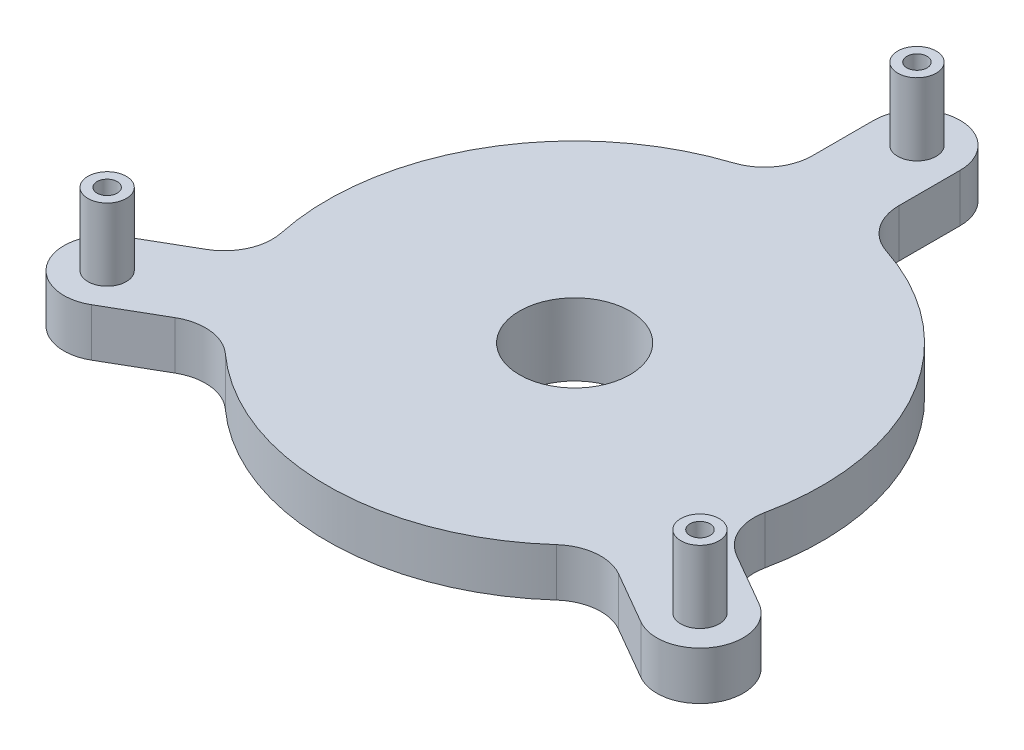
from build123d import *
from build123d.topology import SkipClean

# Parameters (mm, degrees)
SKETCH_1_R               = 82.5
SKETCH_1_R_2             = 11.5
EXTRUDE_1_DEPTH          = 5
SKETCH_2_R               = 4
SKETCH_2_R_2             = 2.1
EXTRUDE_2_DEPTH          = 15
EXTRUDE_START            = 5
SKETCH_3_R               = 34
SKETCH_3_R_2             = 11.5
EXTRUDE_3_DEPTH          = 5
CUT_EXTRUDE_1_DEPTH      = 118.63290356
CUT_EXTRUDE_1_DEPTH_BACK = 10
SKETCH_4_R               = 82.5
EXTRUDE_4_DEPTH          = 5
SKETCH_6_R               = 11.5
CUT_EXTRUDE_2_DEPTH      = 109.80791311
SKETCH_7_R               = 34.75
SKETCH_7_R_2             = 11.5
EXTRUDE_5_DEPTH          = 5


with BuildPart() as part:
    # 草圖1 → 填料-伸長1 (new body)
    with BuildSketch(Plane(origin=(0, 0, 0), x_dir=(1, 0, 0), z_dir=(0, 1, 0))):
        with Locations(Location((0, 0, 0), (0, 0, 270))):
            Circle(SKETCH_1_R)
        with Locations(Location((0, 0, 0), (0, 0, 270))):
            Circle(SKETCH_1_R_2, mode=Mode.SUBTRACT)
    extrude(amount=EXTRUDE_1_DEPTH)

    # 草圖2 → 填料-伸長2 (add)
    # profile 1 of 3: a face of its own
    with BuildSketch(Plane(origin=(0, 5, 0), x_dir=(1, 0, 0), z_dir=(0, 1, 0))):
        with Locations(Location((0, 71.25, 0), (0, 0, 270))):
            Circle(SKETCH_2_R)
        with Locations(Location((0, 71.25, 0), (0, 0, 270))):
            Circle(SKETCH_2_R_2, mode=Mode.SUBTRACT)
    # profile 2 of 3: a face of its own
    with BuildSketch(Plane(origin=(0, 5, 0), x_dir=(1, 0, 0), z_dir=(0, 1, 0))):
        with Locations(Location((61.70431002, -35.625, 0), (0, 0, 270))):
            Circle(SKETCH_2_R)
        with Locations(Location((61.70431002, -35.625, 0), (0, 0, 270))):
            Circle(SKETCH_2_R_2, mode=Mode.SUBTRACT)
    # profile 3 of 3: a face of its own
    with BuildSketch(Plane(origin=(0, 5, 0), x_dir=(1, 0, 0), z_dir=(0, 1, 0))):
        with Locations(Location((-61.70431002, -35.625, 0), (0, 0, 270))):
            Circle(SKETCH_2_R)
        with Locations(Location((-61.70431002, -35.625, 0), (0, 0, 270))):
            Circle(SKETCH_2_R_2, mode=Mode.SUBTRACT)
    extrude(amount=EXTRUDE_2_DEPTH)

    # 草圖3 → 填料-伸長3 (add)
    with SkipClean():  # the faces are left unmerged after this step: merging them gives an invalid solid
        with BuildSketch(Plane.XZ.offset(EXTRUDE_START)):
            with Locations(Location((0, 0, 0), (0, 0, 90))):
                Circle(SKETCH_3_R)
            with Locations(Location((0, 0, 0), (0, 0, 270))):
                Circle(SKETCH_3_R_2, mode=Mode.SUBTRACT)
        extrude(amount=-EXTRUDE_3_DEPTH)

    # 草圖4 → 除料-伸長1 (cut, two sides: drawn at the far end of the back side and taken through both)
    with SkipClean():  # the faces are left unmerged after this step: merging them gives an invalid solid
        with BuildSketch(Plane(origin=(0, 5, 0), x_dir=(1, 0, 0), z_dir=(0, 1, 0)).offset(-CUT_EXTRUDE_1_DEPTH_BACK)):
            Circle(SKETCH_4_R)
            with BuildLine():
                ThreePointArc((-34.463200133, -38.269280586), (0, -51.5), (34.463200133, -38.269280586))
                ThreePointArc((34.463200133, -38.269280586), (40.109412614, -35.755030522), (46.155083654, -37.039954818))
                Line((46.155083654, -37.039954818), (57.20431002, -43.419228634))
                ThreePointArc((57.20431002, -43.419228634), (69.498538654, -40.125), (66.20431002, -27.830771366))
                Line((66.20431002, -27.830771366), (55.155083654, -21.451497549))
                ThreePointArc((55.155083654, -21.451497549), (51.019471053, -16.858254994), (50.373769239, -10.711366518))
                ThreePointArc((50.373769239, -10.711366518), (44.600308295, 25.75), (15.910569106, 48.980647104))
                ThreePointArc((15.910569106, 48.980647104), (10.910058438, 52.613285516), (9, 58.491452367))
                Line((9, 58.491452367), (9, 71.25))
                ThreePointArc((9, 71.25), (0, 80.25), (-9, 71.25))
                Line((-9, 71.25), (-9, 58.491452367))
                ThreePointArc((-9, 58.491452367), (-10.910058438, 52.613285516), (-15.910569106, 48.980647104))
                ThreePointArc((-15.910569106, 48.980647104), (-44.600308295, 25.75), (-50.373769239, -10.711366518))
                ThreePointArc((-50.373769239, -10.711366518), (-51.019471053, -16.858254994), (-55.155083654, -21.451497549))
                Line((-55.155083654, -21.451497549), (-66.20431002, -27.830771366))
                ThreePointArc((-66.20431002, -27.830771366), (-69.498538654, -40.125), (-57.20431002, -43.419228634))
                Line((-57.20431002, -43.419228634), (-46.155083654, -37.039954818))
                ThreePointArc((-46.155083654, -37.039954818), (-40.109412614, -35.755030522), (-34.463200133, -38.269280586))
            make_face(mode=Mode.SUBTRACT)
        extrude(amount=CUT_EXTRUDE_1_DEPTH + CUT_EXTRUDE_1_DEPTH_BACK, mode=Mode.SUBTRACT)

    # 草圖5 → 填料-伸長4 (add)
    with BuildSketch(Plane.XZ):
        with BuildLine():
            Line((-46.155083654, 37.039954818), (-57.20431002, 43.419228634))
            ThreePointArc((-57.20431002, 43.419228634), (-69.498538654, 40.125), (-66.20431002, 27.830771366))
            Line((-66.20431002, 27.830771366), (-55.155083654, 21.451497549))
            ThreePointArc((-55.155083654, 21.451497549), (-51.019471053, 16.858254994), (-50.373769239, 10.711366518))
            ThreePointArc((-50.373769239, 10.711366518), (-44.600308295, -25.75), (-15.910569106, -48.980647104))
            ThreePointArc((-15.910569106, -48.980647104), (-10.910058438, -52.613285516), (-9, -58.491452367))
            Line((-9, -58.491452367), (-9, -71.25))
            ThreePointArc((-9, -71.25), (0, -80.25), (9, -71.25))
            Line((9, -71.25), (9, -58.491452367))
            ThreePointArc((9, -58.491452367), (10.910058438, -52.613285516), (15.910569106, -48.980647104))
            ThreePointArc((15.910569106, -48.980647104), (44.600308295, -25.75), (50.373769239, 10.711366518))
            ThreePointArc((50.373769239, 10.711366518), (51.019471053, 16.858254994), (55.155083654, 21.451497549))
            Line((55.155083654, 21.451497549), (66.20431002, 27.830771366))
            ThreePointArc((66.20431002, 27.830771366), (69.498538654, 40.125), (57.20431002, 43.419228634))
            Line((57.20431002, 43.419228634), (46.155083654, 37.039954818))
            ThreePointArc((46.155083654, 37.039954818), (40.109412614, 35.755030522), (34.463200133, 38.269280586))
            ThreePointArc((34.463200133, 38.269280586), (0, 51.5), (-34.463200133, 38.269280586))
            ThreePointArc((-34.463200133, 38.269280586), (-40.109412614, 35.755030522), (-46.155083654, 37.039954818))
        make_face()
    extrude(amount=EXTRUDE_4_DEPTH)

    # 草圖6 → 除料-伸長2 (cut, through all)
    with BuildSketch(Plane(origin=(0, 0, 0), x_dir=(1, 0, 0), z_dir=(0, 1, 0))):
        with Locations(Location((0, 0, 0), (0, 0, 270))):
            Circle(SKETCH_6_R)
    extrude(amount=-CUT_EXTRUDE_2_DEPTH, mode=Mode.SUBTRACT)

    # 草圖7 → 填料-伸長5 (add)
    with SkipClean():  # the faces are left unmerged after this step: merging them gives an invalid solid
        with BuildSketch(Plane.XZ.offset(5)):
            with Locations(Location((0, 0, 0), (0, 0, 270))):
                Circle(SKETCH_7_R)
            with Locations(Location((0, 0, 0), (0, 0, 270))):
                Circle(SKETCH_7_R_2, mode=Mode.SUBTRACT)
        extrude(amount=EXTRUDE_5_DEPTH)
    add(part.part.scale(1), mode=Mode.REPLACE)  # the faces are merged on a copy


solid = part.part
